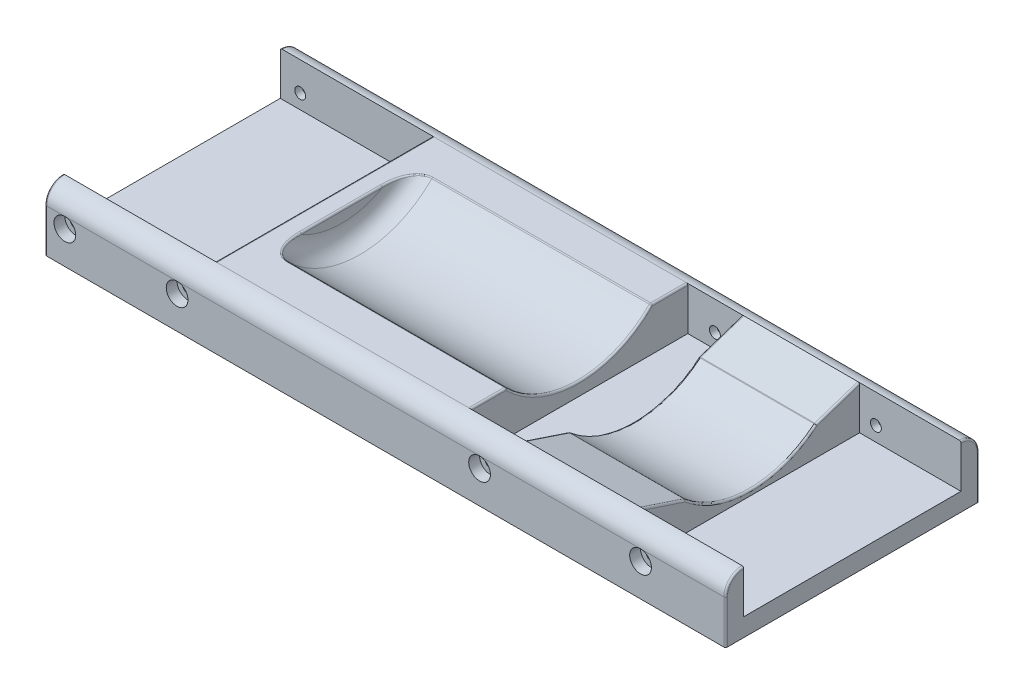
from build123d import *

# Parameters (mm, degrees)
SKETCH2_W            = 188
SKETCH2_H            = 70
BOSS_EXTRUDE1_DEPTH  = 5
BOSS_EXTRUDE2_DEPTH  = 12
BOSS_EXTRUDE3_DEPTH  = 12
CUT_EXTRUDE1_DEPTH   = 5
SKETCH8_W            = 60.55
SKETCH8_H            = 5
BOSS_EXTRUDE4_DEPTH  = 12
BOSS_EXTRUDE6_START  = 61.5
BOSS_EXTRUDE6_DEPTH  = 61.5
SKETCH11_W           = 60.45
SKETCH11_H           = 5
BOSS_EXTRUDE7_DEPTH  = 12
SKETCH14_W           = 32.45
SKETCH14_H           = 60
BOSS_EXTRUDE9_DEPTH  = 8
CUT_EXTRUDE3_DEPTH   = 33
BOSS_EXTRUDE10_DEPTH = 32.45
FILLET3_R            = 5
FILLET4_R            = 0.5
SKETCH18_R           = 1.5
CUT_EXTRUDE5_DEPTH   = 75
SKETCH19_R           = 3
CUT_EXTRUDE6_DEPTH   = 3
CUT_EXTRUDE7_START   = -3
SKETCH20_R           = 3
CUT_EXTRUDE7_DEPTH   = 3


with BuildPart() as part:
    # Sketch2 → Boss-Extrude1 (new body)
    with BuildSketch(Plane(origin=(0, 0, 0), x_dir=(1, 0, 0), z_dir=(0, 1, 0))):
        Rectangle(SKETCH2_W, SKETCH2_H)
    extrude(amount=BOSS_EXTRUDE1_DEPTH)

    # Sketch4 → Boss-Extrude2 (add)
    with BuildSketch(Plane(origin=(0, 5, 0), x_dir=(1, 0, 0), z_dir=(0, 1, 0))):
        Polygon((-47, -35), (-94, -35), (-94, -29.998333952), (-52, -29.998333952), (-52, 29.998333952), (-94, 29.998333952), (-94, 35), (-47, 35), align=None)
    extrude(amount=BOSS_EXTRUDE2_DEPTH)

    # Sketch5 → Boss-Extrude3 (add)
    with BuildSketch(Plane(origin=(0, 5, 0), x_dir=(1, 0, 0), z_dir=(0, 1, 0))):
        Polygon((13.55, 35), (13.55, -35), (33.55, -35), (33.55, -30), (18.55, -30), (18.55, 30), (33.55, 30), (33.55, 35), align=None)
    extrude(amount=BOSS_EXTRUDE3_DEPTH)

    # Sketch6 → Cut-Extrude1 (cut)
    with BuildSketch(Plane.ZY.offset(-13.55)):
        with BuildLine():
            Line((20, 17), (-20, 17))
            ThreePointArc((-20, 17), (0, 8.595917942), (20, 17))
        make_face()
    extrude(amount=-CUT_EXTRUDE1_DEPTH, mode=Mode.SUBTRACT)

    # Sketch8 → Boss-Extrude4 (add)
    with BuildSketch(Plane(origin=(0, 5, 0), x_dir=(1, 0, 0), z_dir=(0, 1, 0))):
        with Locations((-16.725, 32.5)):
            Rectangle(SKETCH8_W, SKETCH8_H)
        with Locations((-16.725, -32.5)):
            Rectangle(SKETCH8_W, SKETCH8_H)
    extrude(amount=BOSS_EXTRUDE4_DEPTH)

    # Sketch10 → Boss-Extrude6 (add)
    with BuildSketch(Plane.ZY.offset(-13.55).offset(BOSS_EXTRUDE6_START)):
        with BuildLine():
            Line((-30, 17), (-30, 5))
            Line((-30, 5), (30, 5))
            Line((30, 5), (30, 17))
            Line((30, 17), (20, 17))
            ThreePointArc((20, 17), (0, 8.595917942), (-20, 17))
            Line((-20, 17), (-30, 17))
        make_face()
    extrude(amount=-BOSS_EXTRUDE6_DEPTH)

    # Sketch11 → Boss-Extrude7 (add)
    with BuildSketch(Plane(origin=(0, 5, 0), x_dir=(1, 0, 0), z_dir=(0, 1, 0))):
        with Locations((63.775, 32.5)):
            Rectangle(SKETCH11_W, SKETCH11_H)
        with Locations((63.775, -32.5)):
            Rectangle(SKETCH11_W, SKETCH11_H)
    extrude(amount=BOSS_EXTRUDE7_DEPTH)

    # Sketch14 → Boss-Extrude9 (add)
    with BuildSketch(Plane(origin=(0, 5, 0), x_dir=(1, 0, 0), z_dir=(0, 1, 0))):
        with Locations((49.775, 0)):
            Rectangle(SKETCH14_W, SKETCH14_H)
    extrude(amount=BOSS_EXTRUDE9_DEPTH)

    # Sketch15 → Cut-Extrude3 (cut)
    with BuildSketch(Plane(origin=(66, 0, 0), x_dir=(0, 0, -1), z_dir=(1, 0, 0))):
        with BuildLine():
            Line((18, 13), (-18, 13))
            ThreePointArc((-18, 13), (0, 6.44761059), (18, 13))
        make_face()
    extrude(amount=-CUT_EXTRUDE3_DEPTH, mode=Mode.SUBTRACT)

    # Sketch17 → Boss-Extrude10 (add)
    with BuildSketch(Plane(origin=(66, 0, 0), x_dir=(0, 0, -1), z_dir=(1, 0, 0))):
        Polygon((-18, 13), (-30, 13), (-30, 17), align=None)
        Polygon((30, 13), (18, 13), (30, 17), align=None)
    extrude(amount=-BOSS_EXTRUDE10_DEPTH)

    # Fillet3
    fillet3_edges = [part.edges().sort_by_distance(p)[0] for p in [
        (0, 17, -35),
        (0, 17, 35),
        (-47, 8.595917942, 0),
    ]]
    fillet(fillet3_edges, radius=FILLET3_R - 0.0001)  # a hair under: the kernel refuses the full size

    # Fillet4
    fillet4_edges = [part.edges().sort_by_distance(p)[0] for p in [
        (49.775, 13, -18),
        (49.775, 13, 18),
        (33.55, 6.44761059, 0),
        (66, 6.44761059, 0),
        (33.55, 15, 24),
        (66, 15, 24),
        (33.55, 15, -24),
        (66, 15, -24),
        (-47, 17, 0),
        (-94, 17, -29.999216976),
        (-52, 17, 0),
        (-94, 6.00005, 35),
        (-94, 6.00005, -35),
        (-94, 15.535563195, 33.535563195),
        (-94, 15.535563195, -33.535563195),
        (94, 6.00005, -35),
        (-94, 17, 29.999216976),
        (94, 6.00005, 35),
        (94, 15.535563195, 33.535563195),
        (94, 15.535563195, -33.535563195),
        (-45.99369343, 17, 17.100872289),
        (-45.99369343, 17, -17.100872289),
        (18.55, 17, 25),
        (18.55, 17, -25),
        (18.55, 8.595917942, 0),
        (-11.72505, 17, 20),
        (-11.72505, 17, -20),
    ]]
    fillet(fillet4_edges, radius=FILLET4_R)

    # Sketch18 → Cut-Extrude5 (cut)
    with BuildSketch(Plane.XY.offset(35)):
        with Locations((-88.5, 9)):
            Circle(SKETCH18_R)
        with Locations((-57.5, 9)):
            Circle(SKETCH18_R)
        with Locations((26.046538957, 9)):
            Circle(SKETCH18_R)
        with Locations((70.5, 9)):
            Circle(SKETCH18_R)
    extrude(amount=-CUT_EXTRUDE5_DEPTH, mode=Mode.SUBTRACT)

    # Sketch19 → Cut-Extrude6 (cut)
    with BuildSketch(Plane.XY.offset(35)):
        with Locations((-88.5, 9)):
            Circle(SKETCH19_R)
        with Locations((-57.5, 9)):
            Circle(SKETCH19_R)
        with Locations((26.046538957, 9)):
            Circle(SKETCH19_R)
        with Locations((70.5, 9)):
            Circle(SKETCH19_R)
    extrude(amount=-CUT_EXTRUDE6_DEPTH, mode=Mode.SUBTRACT)

    # Sketch20 → Cut-Extrude7 (cut)
    with BuildSketch(Plane(origin=(0, 0, -35), x_dir=(-1, 0, 0), z_dir=(0, 0, -1)).offset(CUT_EXTRUDE7_START)):
        with Locations(Location((-70.5, 9, 0), (0, 0, 180))):
            Circle(SKETCH20_R)
        with Locations(Location((-26.046538957, 9, 0), (0, 0, 180))):
            Circle(SKETCH20_R)
        with Locations(Location((57.5, 9, 0), (0, 0, 180))):
            Circle(SKETCH20_R)
        with Locations(Location((88.5, 9, 0), (0, 0, 180))):
            Circle(SKETCH20_R)
    extrude(amount=CUT_EXTRUDE7_DEPTH, mode=Mode.SUBTRACT)


solid = part.part
